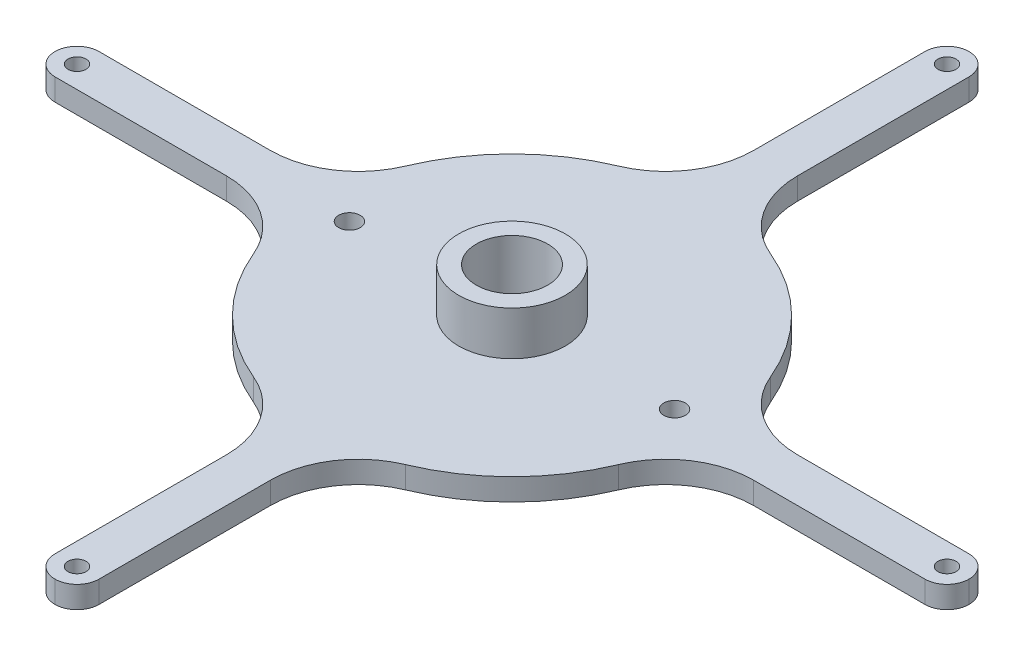
from build123d import *

# Parameters (mm, degrees)
CROQUIS1_R              = 45
CROQUIS1_R_2            = 2.45
CROQUIS1_R_3            = 8.125
SALIENTE_EXTRUIR1_DEPTH = 5
CROQUIS1_2_R            = 12.125
CROQUIS1_2_R_2          = 8.125
EXTRUIR_L_MINA1_DEPTH   = 15
CROQUIS2_R              = 2.425
CORTAR_EXTRUIR2_DEPTH   = 3
CROQUIS3_W              = 59.27864045
CROQUIS3_H              = 10
CROQUIS3_R              = 2.05
CROQUIS3_W_2            = 10
CROQUIS3_H_2            = 59.27864045
SALIENTE_EXTRUIR2_DEPTH = 5
REDONDEO1_R             = 5
REDONDEO2_R             = 20


with BuildPart() as part:
    # Croquis1 → Saliente-Extruir1 (new body)
    with BuildSketch(Plane(origin=(0, 0, 0), x_dir=(1, 0, 0), z_dir=(0, 1, 0))):
        with Locations(Location((0, 0, 0), (0, 0, 270))):
            Circle(CROQUIS1_R)
        with Locations(Location((37, 0, 0), (0, 0, 270))):
            Circle(CROQUIS1_R_2, mode=Mode.SUBTRACT)
        with Locations(Location((-37, 0, 0), (0, 0, 90))):
            Circle(CROQUIS1_R_2, mode=Mode.SUBTRACT)
        with Locations(Location((0, 0, 0), (0, 0, 270))):
            Circle(CROQUIS1_R_3, mode=Mode.SUBTRACT)
    extrude(amount=SALIENTE_EXTRUIR1_DEPTH)

    # Croquis1<2> → Extruir-Lámina1 (add)
    with BuildSketch(Plane(origin=(0, 0, 0), x_dir=(1, 0, 0), z_dir=(0, 1, 0))):
        Circle(CROQUIS1_2_R)
        Circle(CROQUIS1_2_R_2, mode=Mode.SUBTRACT)
    extrude(amount=EXTRUIR_L_MINA1_DEPTH)

    # Croquis2 → Cortar-Extruir2 (cut)
    with BuildSketch(Plane(origin=(-12.125, 0, -11.125), x_dir=(0, 0, -1), z_dir=(1, 0, 0))):
        with Locations(Location((-11.125, 10, 0), (0, 0, 180))):
            Circle(CROQUIS2_R)
    extrude(amount=CORTAR_EXTRUIR2_DEPTH, mode=Mode.SUBTRACT)

    # Croquis3 → Saliente-Extruir2 (add)
    # profile 1 of 4: a face of its own
    with BuildSketch(Plane(origin=(0, 0, 0), x_dir=(1, 0, 0), z_dir=(0, 1, 0))):
        with Locations((74.360679775, 0)):
            Rectangle(CROQUIS3_W, CROQUIS3_H)
        with Locations(Location((99, 0, 0), (0, 0, 270))):
            Circle(CROQUIS3_R, mode=Mode.SUBTRACT)
    # profile 2 of 4: a face of its own
    with BuildSketch(Plane(origin=(0, 0, 0), x_dir=(1, 0, 0), z_dir=(0, 1, 0))):
        with Locations((0, 74.360679775)):
            Rectangle(CROQUIS3_W_2, CROQUIS3_H_2)
        with Locations(Location((0, 99, 0), (0, 0, 270))):
            Circle(CROQUIS3_R, mode=Mode.SUBTRACT)
    # profile 3 of 4: a face of its own
    with BuildSketch(Plane(origin=(0, 0, 0), x_dir=(1, 0, 0), z_dir=(0, 1, 0))):
        with Locations((0, -74.360679775)):
            Rectangle(CROQUIS3_W_2, CROQUIS3_H_2)
        with Locations(Location((0, -99, 0), (0, 0, 270))):
            Circle(CROQUIS3_R, mode=Mode.SUBTRACT)
    # profile 4 of 4: a face of its own
    with BuildSketch(Plane(origin=(0, 0, 0), x_dir=(1, 0, 0), z_dir=(0, 1, 0))):
        with Locations((-74.360679775, 0)):
            Rectangle(CROQUIS3_W, CROQUIS3_H)
        with Locations(Location((-99, 0, 0), (0, 0, 270))):
            Circle(CROQUIS3_R, mode=Mode.SUBTRACT)
    extrude(amount=SALIENTE_EXTRUIR2_DEPTH)

    # Redondeo1
    redondeo1_edges = [part.edges().sort_by_distance(p)[0] for p in [
        (5, 2.5, 104),
        (-5, 2.5, 104),
        (-104, 2.5, 5),
        (-104, 2.5, -5),
        (-5, 2.5, -104),
        (5, 2.5, -104),
        (104, 2.5, -5),
        (104, 2.5, 5),
    ]]
    fillet(redondeo1_edges, radius=REDONDEO1_R - 0.0001)  # a hair under: the kernel refuses the full size

    # Redondeo2
    redondeo2_edges = [part.edges().sort_by_distance(p)[0] for p in [
        (-5, 2.5, -44.72135955),
        (5, 2.5, -44.72135955),
        (44.72135955, 2.5, -5),
        (44.72135955, 2.5, 5),
        (5, 2.5, 44.72135955),
        (-5, 2.5, 44.72135955),
        (-44.72135955, 2.5, 5),
        (-44.72135955, 2.5, -5),
    ]]
    fillet(redondeo2_edges, radius=REDONDEO2_R)


solid = part.part
